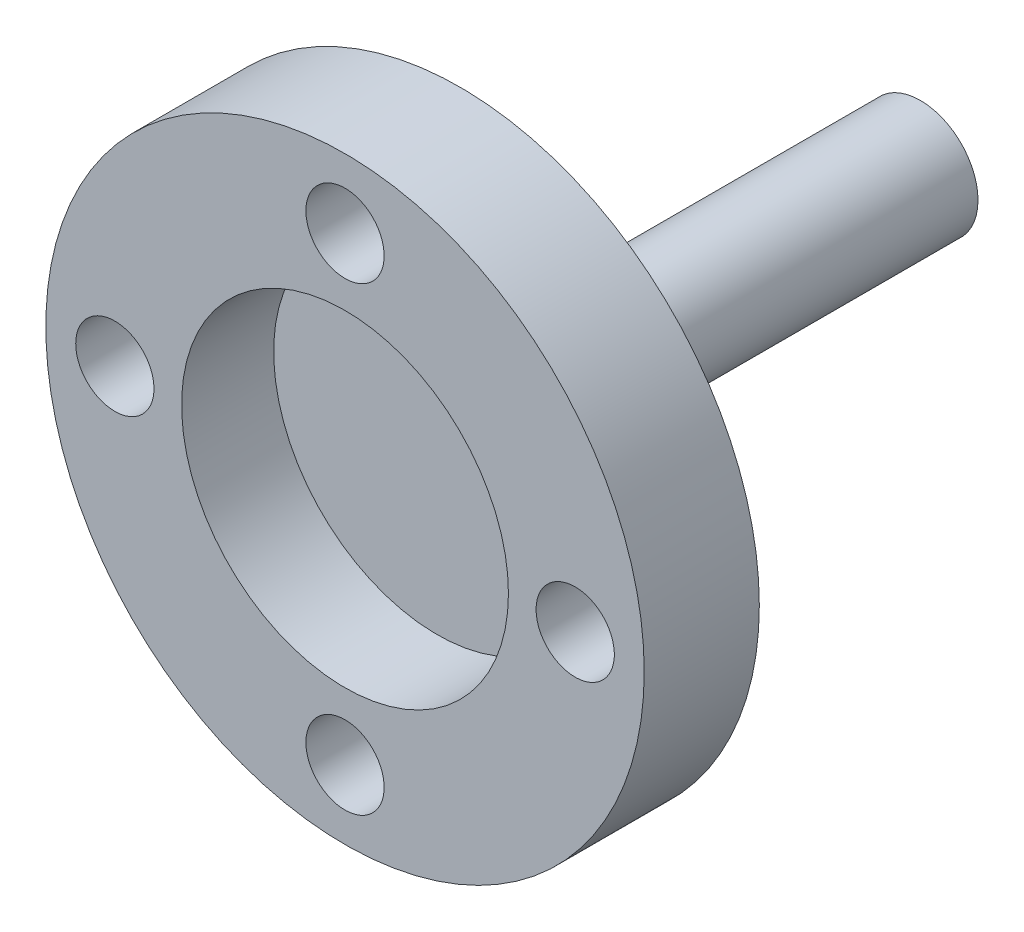
from build123d import *

# Parameters (mm, degrees)
SKETCH_1_R          = 13
EXTRUDE_1_DEPTH     = 5
SKETCH_2_R          = 7.1
CUT_EXTRUDE_1_DEPTH = 4
SKETCH_3_R          = 2.5
EXTRUDE_2_DEPTH     = 20
HOLE_WIZARD_M31_D   = 3.4


with BuildPart() as part:
    # Эскиз1 → Бобышка-Вытянуть1 (new body)
    with BuildSketch(Plane.XY):
        Circle(SKETCH_1_R)
    extrude(amount=EXTRUDE_1_DEPTH)

    # Эскиз2 → Вырез-Вытянуть1 (cut)
    with BuildSketch(Plane.XY.offset(5)):
        Circle(SKETCH_2_R)
    extrude(amount=-CUT_EXTRUDE_1_DEPTH, mode=Mode.SUBTRACT)

    # Эскиз3 → Бобышка-Вытянуть2 (add)
    with BuildSketch(Plane(origin=(0, 0, 0), x_dir=(-1, 0, 0), z_dir=(0, 0, -1))):
        Circle(SKETCH_3_R)
    extrude(amount=EXTRUDE_2_DEPTH)

    # Отверстие с зазором M31 (through all)
    with Locations(Plane(origin=(0, 0, 0), x_dir=(-1, 0, 0), z_dir=(0, 0, -1))):
        with Locations((0, 10), (-10, 0), (0, -10), (10, 0)):
            Hole(HOLE_WIZARD_M31_D / 2)


solid = part.part
